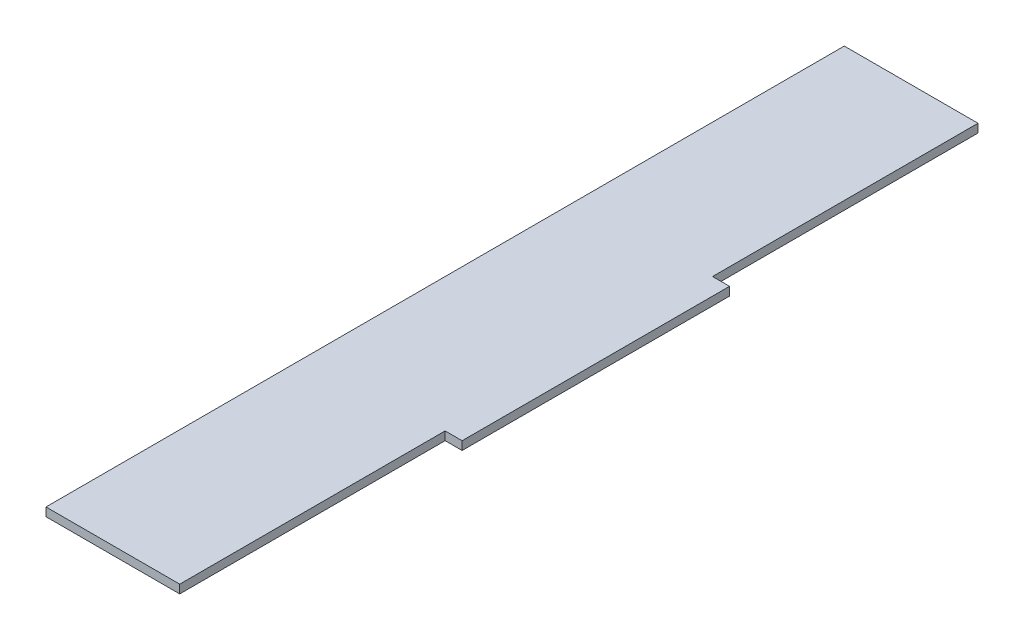
from build123d import *

# Parameters (mm, degrees)
BOSS_EXTRUDE1_DEPTH = 3.175


with BuildPart() as part:
    # Sketch1 → Boss-Extrude1 (new body)
    with BuildSketch(Plane(origin=(0, 0, 0), x_dir=(1, 0, 0), z_dir=(0, 1, 0))):
        Polygon((25, 99.25), (-25, 99.25), (-25, 0), (-25, -100), (-25, -199.25), (25, -199.25), (25, -100), (31.35, -100), (31.35, 0), (25, 0), align=None)
    extrude(amount=BOSS_EXTRUDE1_DEPTH)


solid = part.part
